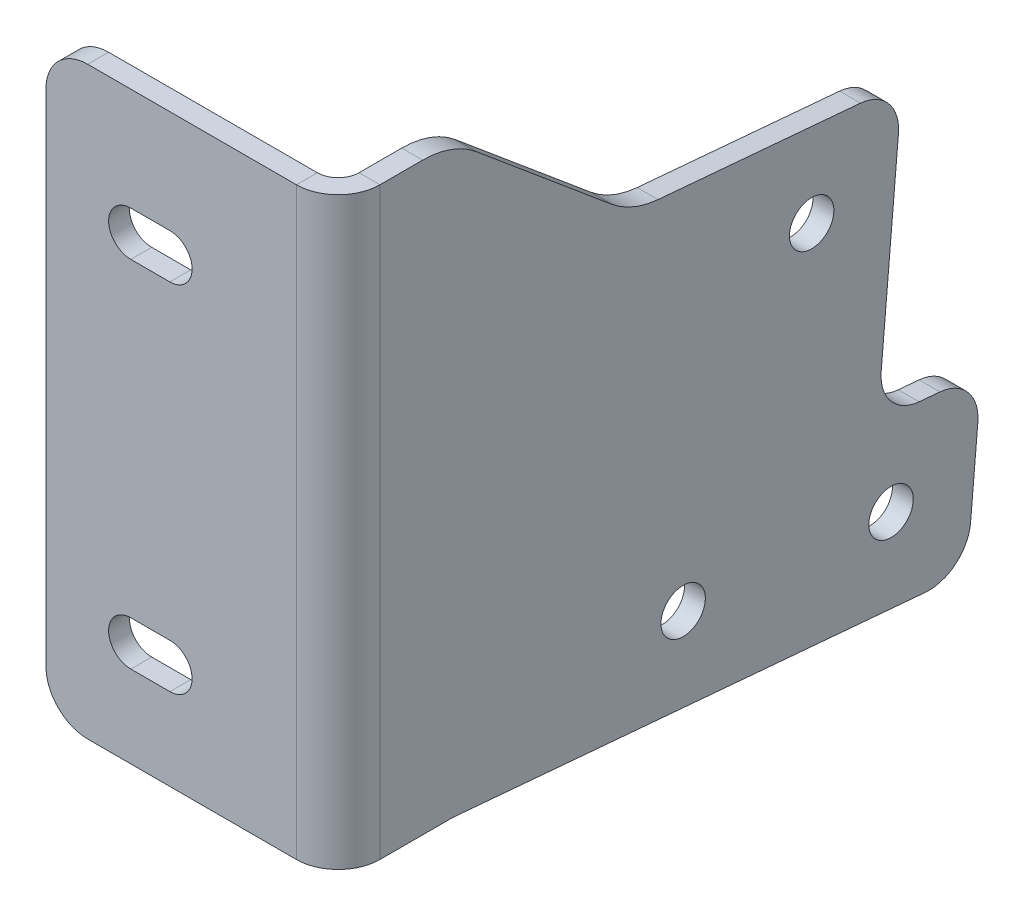
from build123d import *

# Parameters (mm, degrees)
SKETCH1_W                    = 44.45
SKETCH1_H                    = 88.9
BASE_FLANGE1_DEPTH           = 3.175
EDGE_FLANGE1_STRIP_W         = 19.05
EDGE_FLANGE1_STRIP_H         = 3.175
EDGE_FLANGE1_STRIP_CUT_DEPTH = 88.9
EDGE_FLANGE1_DEPTH           = 88.9
BOSS_EXTRUDE1_DEPTH          = 3.175
F_1_4_START                  = -4
F_1_4_CLEARANCE_SLOT1_DEPTH  = 5
F_1_4_CLEARANCE_HOLE1_D      = 6.7564
CUT_EXTRUDE1_DEPTH           = 139.903982124
FILLET1_R                    = 12.7
FILLET2_R                    = 6.35
BODY_MOVE_COPY1_START        = -3.175
BODY_MOVE_COPY1_OUTLINE_R    = 3.3782
BODY_MOVE_COPY1_DEPTH        = 3.175
BODY_MOVE_COPY1_2_OUTLINE_R  = 3.3782
BODY_MOVE_COPY1_2_DEPTH      = 3.175
BODY_MOVE_COPY1_3_DEPTH      = 88.9
BODY_MOVE_COPY1_4_DEPTH      = 88.9
BODY_MOVE_COPY1_START_2      = -9.676072597
BODY_MOVE_COPY1_5_DEPTH      = 13.676072597
BODY_MOVE_COPY1_6_DEPTH      = 88.9


with BuildPart() as part:
    # Base-Flange1: sheet metal written as solids
    # Sketch1 → Base-Flange1 (new body)
    with BuildSketch(Plane.XY):
        with Locations((-22.225, 44.45)):
            Rectangle(SKETCH1_W, SKETCH1_H)
    extrude(amount=-BASE_FLANGE1_DEPTH)

    # Edge-Flange1: sheet metal written as solids
    # Edge-Flange1 strip (on a plane across the edge) → Edge-Flange1 strip cut (cut)
    with BuildSketch(Plane(origin=(0, 0, 0), x_dir=(-1, 0, 0), z_dir=(0, 1, 0))):
        with Locations((-3.175, -1.5875)):
            Rectangle(EDGE_FLANGE1_STRIP_W, EDGE_FLANGE1_STRIP_H)
    extrude(amount=EDGE_FLANGE1_STRIP_CUT_DEPTH, mode=Mode.SUBTRACT)

    # Edge-Flange1 section (on a plane across the edge) → Edge-Flange1 (add)
    with BuildSketch(Plane(origin=(0, 0, 0), x_dir=(-1, 0, 0), z_dir=(0, 1, 0))):
        with BuildLine():
            Line((0, 3.175), (0, 14.2875))
            Line((0, 14.2875), (3.175, 14.2875))
            Line((3.175, 14.2875), (3.175, 3.175))
            ThreePointArc((3.175, 3.175), (4.10493597, 0.92993597), (6.35, 0))
            Line((6.35, 0), (6.35, -3.175))
            ThreePointArc((6.35, -3.175), (1.859871939, -1.315128061), (0, 3.175))
        make_face()
    extrude(amount=EDGE_FLANGE1_DEPTH)

    # Sketch9 → Boss-Extrude1 (add)
    with BuildSketch(Plane.ZY.offset(3.175)):
        Polygon((35.543004115, -1.859615648), (92.475531111, -6.840566346), (98.425, 61.162174233), (41.492473004, 66.143124931), (14.2875, 88.9), (14.2875, 0), align=None)
    extrude(amount=-BOSS_EXTRUDE1_DEPTH)

    # 1/4 Clearance Slot1: read off the stored shape, not the designer's step
    # 1/4 Clearance Slot1 outline → 1/4 Clearance Slot1 (cut)
    with BuildSketch(Plane.XY.offset(F_1_4_START)):
        with BuildLine():
            Line((-31.5468, 12.4968), (-25.6032, 12.4968))
            ThreePointArc((-25.6032, 12.4968), (-22.225, 15.875), (-25.6032, 19.2532))
            Line((-25.6032, 19.2532), (-31.5468, 19.2532))
            ThreePointArc((-31.5468, 19.2532), (-34.925, 15.875), (-31.5468, 12.4968))
        make_face()
        with BuildLine():
            Line((-31.5468, 66.4718), (-25.6032, 66.4718))
            ThreePointArc((-25.6032, 66.4718), (-22.225, 69.85), (-25.6032, 73.2282))
            Line((-25.6032, 73.2282), (-31.5468, 73.2282))
            ThreePointArc((-31.5468, 73.2282), (-34.925, 69.85), (-31.5468, 66.4718))
        make_face()
    extrude(amount=F_1_4_CLEARANCE_SLOT1_DEPTH, mode=Mode.SUBTRACT)

    # 1/4 Clearance Hole1 (through all)
    with Locations(Plane.ZY.offset(3.175)):
        with Locations((68.851858569, 51.000976916), (49.301554713, 9.685179085), (80.930736378, 6.917984253)):
            Hole(F_1_4_CLEARANCE_HOLE1_D / 2)

    # Sketch16 → Cut-Extrude1 (cut, through all)
    with BuildSketch(Plane.ZY.offset(3.175)):
        Polygon((82.610409168, 62.545771649), (78.874696144, 19.846376402), (94.689286976, 18.462778986), (98.425, 61.162174233), align=None)
    extrude(amount=-CUT_EXTRUDE1_DEPTH, mode=Mode.SUBTRACT)

    # Fillet1
    # the kernel refuses this fillet: 12.7 mm, written as the material it adds along each edge
    with BuildSketch(Plane(origin=(0, 0, 14.2875), x_dir=(0, 0, -1), z_dir=(-1, 0, 0))) as fillet1_piece_1:
        with BuildLine():
            CenterArc((FILLET1_R * 0.0436609429085, FILLET1_R), FILLET1_R, 265, 5)
            Line((-FILLET1_R * 0.0434947998391, FILLET1_R * 0.00380530190825), (0, 0))
            Line((0, 0), (FILLET1_R * 0.0436609429085, 0))
        make_face()
    extrude(amount=3.175)
    with BuildSketch(Plane(origin=(-3.175, 66.143124931, 41.492473004), x_dir=(-2.6754118461414197e-15, 0.6416153350460704, -0.7670265717911726), z_dir=(1, 0, 0))) as fillet1_piece_2:
        with BuildLine():
            CenterArc((FILLET1_R * 0.314458316587, FILLET1_R), FILLET1_R, 235.087623307, 34.912376693)
            Line((-FILLET1_R * 0.257864707828, FILLET1_R * 0.179971734802), (0, 0))
            Line((0, 0), (FILLET1_R * 0.314458316587, 0))
        make_face()
    extrude(amount=3.175)
    # the kernel refuses this fillet: 12.7 mm, written as the material it takes off along each edge
    with BuildSketch(Plane(origin=(11.528568508, 88.9, 14.2875), x_dir=(0, 0, -1), z_dir=(-1, 0, 0))) as fillet1_2_piece_1:
        with BuildLine():
            CenterArc((FILLET1_R * 0.363104519926, FILLET1_R), FILLET1_R, 230.087623307, 39.912376693)
            Line((-FILLET1_R * 0.27851081512, FILLET1_R * 0.232973428209), (0, 0))
            Line((0, 0), (FILLET1_R * 0.363104519926, 0))
        make_face()
    extrude(amount=26.232137015, mode=Mode.SUBTRACT)

    # Fillet2
    fillet2_edges = [part.edges().sort_by_distance(p)[0] for p in [
        (-1.5875, 18.462778986, 94.689286976),
        (-1.5875, 62.545771649, 82.610409168),
        (-1.5875, 19.846376402, 78.874696144),
        (-1.5875, -6.840566346, 92.475531111),
        (-44.45, 88.9, -1.5875),
        (-44.45, 0, -1.5875),
    ]]
    fillet(fillet2_edges, radius=FILLET2_R)

    # Body-Move/Copy1: read off the stored shape, not the designer's step
    # Body-Move/Copy1 outline → Body-Move/Copy1 (cut)
    with BuildSketch(Plane.YZ.offset(BODY_MOVE_COPY1_START)):
        with BuildLine():
            Line((0, 3.175), (88.9, 3.175))
            Line((88.9, 3.175), (88.9, 9.676072597))
            ThreePointArc((88.9, 9.676072597), (88.137414204, 14.010601651), (85.941237462, 17.824587352))
            Line((85.941237462, 17.824587352), (68.705493163, 38.42925987))
            ThreePointArc((68.705493163, 38.42925987), (66.709747696, 41.726668389), (65.795057959, 45.470896693))
            Line((65.795057959, 45.470896693), (63.099210615, 76.284572835))
            ThreePointArc((63.099210615, 76.284572835), (60.855075604, 80.595516082), (56.219935316, 82.056970201))
            Line((56.219935316, 82.056970201), (26.172212735, 79.428135111))
            ThreePointArc((26.172212735, 79.428135111), (21.537072447, 80.88958923), (19.292937436, 85.200532477))
            Line((19.292937436, 85.200532477), (19.016217952, 88.363450644))
            ThreePointArc((19.016217952, 88.363450644), (16.772082941, 92.674393891), (12.136942653, 94.13584801))
            Line((12.136942653, 94.13584801), (-0.514730013, 93.028970077))
            ThreePointArc((-0.514730013, 93.028970077), (-4.82567326, 90.784835066), (-6.287127379, 86.149694778))
            Line((-6.287127379, 86.149694778), (-0.048327334, 14.839883958))
            ThreePointArc((-0.048327334, 14.839883958), (-0.012087586, 14.286972245), (0, 13.733006025))
            Line((0, 13.733006025), (0, 3.175))
        make_face()
        with Locations((9.685179085, 49.301554713)):
            Circle(BODY_MOVE_COPY1_OUTLINE_R, mode=Mode.SUBTRACT)
        with Locations((6.917984253, 80.930736378)):
            Circle(BODY_MOVE_COPY1_OUTLINE_R, mode=Mode.SUBTRACT)
        with Locations((51.000976916, 68.851858569)):
            Circle(BODY_MOVE_COPY1_OUTLINE_R, mode=Mode.SUBTRACT)
    extrude(amount=BODY_MOVE_COPY1_DEPTH, mode=Mode.SUBTRACT)

    # Body-Move_Copy1 3 outline → Body-Move_Copy1 3 (cut)
    with BuildSketch(Plane(origin=(0, 0, 0), x_dir=(1, 0, 0), z_dir=(0, 1, 0))):
        with BuildLine():
            ThreePointArc((-0.850738685, 0), (-1.90100414, -1.355886872), (-3.275819469, -2.381250001))
            ThreePointArc((-3.275819469, -2.381250001), (-3.200305714, -2.774936372), (-3.175, -3.175))
            Line((-3.175, -3.175), (0, -3.175))
            ThreePointArc((0, -3.175), (-0.216371003, -1.531499064), (-0.850738685, 0))
        make_face()
    extrude(amount=BODY_MOVE_COPY1_3_DEPTH, mode=Mode.SUBTRACT)



with BuildPart() as body_2:
    # Body-Move_Copy1 2 outline → Body-Move_Copy1 2 (new body)
    with BuildSketch(Plane.YZ.offset(BODY_MOVE_COPY1_START)):
        with BuildLine():
            ThreePointArc((56.219935316, -82.056970201), (60.855075604, -80.595516082), (63.099210615, -76.284572835))
            Line((63.099210615, -76.284572835), (65.795057959, -45.470896693))
            ThreePointArc((65.795057959, -45.470896693), (66.709747696, -41.726668389), (68.705493163, -38.42925987))
            Line((68.705493163, -38.42925987), (85.941237462, -17.824587352))
            ThreePointArc((85.941237462, -17.824587352), (88.137414204, -14.010601651), (88.9, -9.676072597))
            Line((88.9, -9.676072597), (88.9, -3.175))
            Line((88.9, -3.175), (0, -3.175))
            Line((0, -3.175), (0, -13.733006025))
            ThreePointArc((0, -13.733006025), (-0.012087586, -14.286972245), (-0.048327334, -14.839883958))
            Line((-0.048327334, -14.839883958), (-6.287127379, -86.149694778))
            ThreePointArc((-6.287127379, -86.149694778), (-4.82567326, -90.784835066), (-0.514730013, -93.028970077))
            Line((-0.514730013, -93.028970077), (12.136942653, -94.13584801))
            ThreePointArc((12.136942653, -94.13584801), (16.772082941, -92.674393891), (19.016217952, -88.363450644))
            Line((19.016217952, -88.363450644), (19.292937436, -85.200532477))
            ThreePointArc((19.292937436, -85.200532477), (21.537072447, -80.88958923), (26.172212735, -79.428135111))
            Line((26.172212735, -79.428135111), (56.219935316, -82.056970201))
        make_face()
        with Locations((6.917984253, -80.930736378)):
            Circle(BODY_MOVE_COPY1_2_OUTLINE_R, mode=Mode.SUBTRACT)
        with Locations((9.685179085, -49.301554713)):
            Circle(BODY_MOVE_COPY1_2_OUTLINE_R, mode=Mode.SUBTRACT)
        with Locations((51.000976916, -68.851858569)):
            Circle(BODY_MOVE_COPY1_2_OUTLINE_R, mode=Mode.SUBTRACT)
    extrude(amount=BODY_MOVE_COPY1_2_DEPTH)


with BuildPart() as part_1:
    add(part.part)

    add(body_2.part)  # Body-Move_Copy1 4 merges body 2
    # Body-Move_Copy1 4 outline → Body-Move_Copy1 4 (add)
    with BuildSketch(Plane(origin=(0, 0, 0), x_dir=(1, 0, 0), z_dir=(0, 1, 0))):
        with BuildLine():
            Line((-44.45, -3.175), (-6.35, -3.175))
            ThreePointArc((-6.35, -3.175), (-4.7625, -2.973361062), (-3.275819469, -2.381250001))
            ThreePointArc((-3.275819469, -2.381250001), (-4.405717517, -0.664942108), (-6.35, 0))
            ThreePointArc((-6.35, 0), (-4.405717517, 0.664942108), (-3.275819469, 2.381250001))
            ThreePointArc((-3.275819469, 2.381250001), (-4.7625, 2.973361062), (-6.35, 3.175))
            Line((-6.35, 3.175), (-44.45, 3.175))
            Line((-44.45, 3.175), (-44.45, -3.175))
        make_face()
        with BuildLine():
            ThreePointArc((-3.275819469, 2.381250001), (-1.90100414, 1.355886872), (-0.850738685, 0))
            ThreePointArc((-0.850738685, 0), (-0.216371003, 1.531499064), (0, 3.175))
            Line((0, 3.175), (-3.175, 3.175))
            ThreePointArc((-3.175, 3.175), (-3.200305714, 2.774936372), (-3.275819469, 2.381250001))
        make_face()
    extrude(amount=BODY_MOVE_COPY1_4_DEPTH)

    # Body-Move_Copy1 5 outline → Body-Move_Copy1 5 (cut)
    with BuildSketch(Plane.XY.offset(BODY_MOVE_COPY1_START_2)):
        with BuildLine():
            ThreePointArc((-25.6032, 12.4968), (-22.225, 15.875), (-25.6032, 19.2532))
            Line((-25.6032, 19.2532), (-31.5468, 19.2532))
            ThreePointArc((-31.5468, 19.2532), (-34.925, 15.875), (-31.5468, 12.4968))
            Line((-31.5468, 12.4968), (-25.6032, 12.4968))
        make_face()
        with BuildLine():
            ThreePointArc((-25.6032, 66.4718), (-22.225, 69.85), (-25.6032, 73.2282))
            Line((-25.6032, 73.2282), (-31.5468, 73.2282))
            ThreePointArc((-31.5468, 73.2282), (-34.925, 69.85), (-31.5468, 66.4718))
            Line((-31.5468, 66.4718), (-25.6032, 66.4718))
        make_face()
        with BuildLine():
            Line((-44.45, 88.9), (-44.45, 82.55))
            ThreePointArc((-44.45, 82.55), (-42.590128061, 87.040128061), (-38.1, 88.9))
            Line((-38.1, 88.9), (-44.45, 88.9))
        make_face()
        with BuildLine():
            ThreePointArc((-38.1, 0), (-42.590128061, 1.859871939), (-44.45, 6.35))
            Line((-44.45, 6.35), (-44.45, 0))
            Line((-44.45, 0), (-38.1, 0))
        make_face()
    extrude(amount=BODY_MOVE_COPY1_5_DEPTH, mode=Mode.SUBTRACT)

    # Body-Move_Copy1 6 outline → Body-Move_Copy1 6 (cut)
    with BuildSketch(Plane(origin=(0, 0, 0), x_dir=(1, 0, 0), z_dir=(0, 1, 0))):
        with BuildLine():
            ThreePointArc((-6.35, 0), (-4.405717517, 0.664942108), (-3.275819469, 2.381250001))
            ThreePointArc((-3.275819469, 2.381250001), (-4.7625, 2.973361062), (-6.35, 3.175))
            Line((-6.35, 3.175), (-44.45, 3.175))
            Line((-44.45, 3.175), (-44.45, 0))
            Line((-44.45, 0), (-6.35, 0))
        make_face()
    extrude(amount=BODY_MOVE_COPY1_6_DEPTH, mode=Mode.SUBTRACT)


solid = part_1.part
